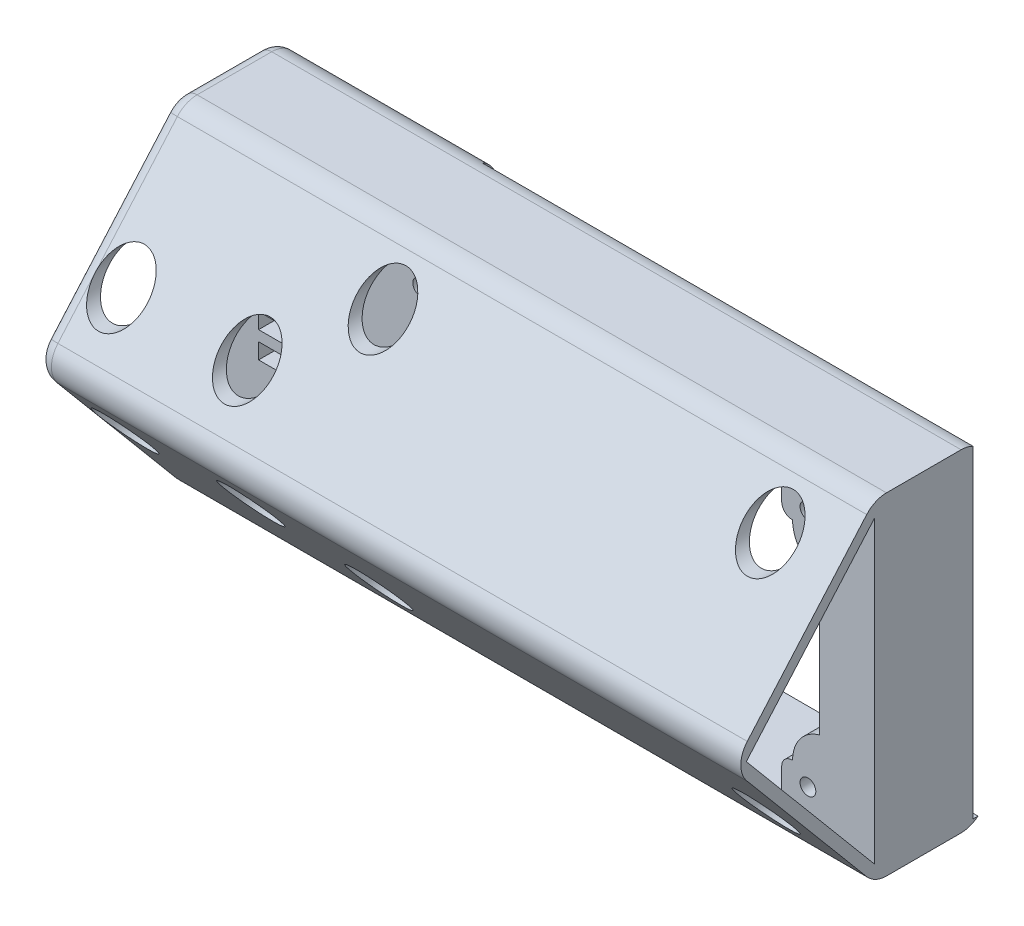
from build123d import *

# Parameters (mm, degrees)
SKETCH5_W                           = 21.5
SKETCH5_H                           = 63.28
BOSS_EXTRUDE1_DEPTH                 = 133.94
F_3_0MM_DOWEL_HOLE4_D               = 3
F_3_0MM_DOWEL_HOLE4_CSINK_D         = 3.05
F_3_0MM_DOWEL_HOLE4_CSINK_ANGLE     = 90
SKETCH8_W                           = 67.97603897
SKETCH8_H                           = 39.69603897
CUT_EXTRUDE1_DEPTH                  = 150.688115761
SKETCH9_W                           = 84.64
SKETCH9_H                           = 56.36
CUT_EXTRUDE2_DEPTH                  = 6.5
SKETCH10_W                          = 93.64
SKETCH10_H                          = 62.2
CUT_EXTRUDE3_DEPTH                  = 2.75
CUT_EXTRUDE4_DEPTH                  = 15.5
SKETCH38_R                          = 4
CUT_EXTRUDE13_DEPTH                 = 4
CUT_EXTRUDE5_START                  = -21.5
SKETCH23_W                          = 78.2
SKETCH23_H                          = 26.2
CUT_EXTRUDE5_DEPTH                  = 172.188115761
SKETCH39_W                          = 63.84
SKETCH39_H                          = 39.69603897
CUT_EXTRUDE15_DEPTH                 = 149.893525716
SKETCH30_W                          = 6
SKETCH30_H                          = 3
CUT_EXTRUDE7_DEPTH                  = 150.688115761
BOSS_EXTRUDE4_START                 = -15.5
SKETCH30_3_W                        = 6
SKETCH30_3_H                        = 2
BOSS_EXTRUDE4_DEPTH                 = 3.5
BOSS_EXTRUDE3_DEPTH                 = 133.94
SKETCH32_R                          = 1.8
CUT_EXTRUDE8_DEPTH                  = 6
FILLET1_R                           = 5
FILLET5_R                           = 2.5
FILLET8_R                           = 2.5
FILLET15_R                          = 7
FILLET16_R                          = 0.5
FILLET17_R                          = 2
FILLET18_R                          = 2
SKETCH41_W                          = 5
SKETCH41_H                          = 25.503899949
F_10_0_10_DIAMETER_HOLE1_AT_2_COUNT = 2
F_10_0_10_DIAMETER_HOLE1_AT_2_PITCH = 73.84
F_10_0_10_DIAMETER_HOLE1_AT_3_COUNT = 2
F_10_0_10_DIAMETER_HOLE1_AT_3_PITCH = 86.764389008
F_10_0_10_DIAMETER_HOLE1_AT_4_COUNT = 2
F_10_0_10_DIAMETER_HOLE1_AT_4_PITCH = 45.56
F_10_0_10_DIAMETER_HOLE1_AT_5_COUNT = 2
F_10_0_10_DIAMETER_HOLE1_AT_5_PITCH = 19.576169186
F_10_0_10_DIAMETER_HOLE1_AT_6_COUNT = 2
F_10_0_10_DIAMETER_HOLE1_AT_6_PITCH = 41.502125247
F_10_0_10_DIAMETER_HOLE1_AT_7_COUNT = 2
F_10_0_10_DIAMETER_HOLE1_AT_7_PITCH = 53.353410388
F_10_0_10_DIAMETER_HOLE1_AT_8_COUNT = 2
F_10_0_10_DIAMETER_HOLE1_AT_8_PITCH = 38.825074372


with BuildPart() as part:
    # Sketch5 → Boss-Extrude1 (new body)
    with BuildSketch(Plane(origin=(0, 0, 0), x_dir=(0, 0, -1), z_dir=(1, 0, 0))):
        with Locations((10.75, 31.64)):
            Rectangle(SKETCH5_W, SKETCH5_H)
    extrude(amount=-BOSS_EXTRUDE1_DEPTH)

    # Ø3.0mm Dowel Hole4 (through all)
    with Locations(Plane(origin=(0, 0, -21.5), x_dir=(-1, 0, 0), z_dir=(0, 0, -1))):
        with Locations((12.7, 55.06), (86.54, 55.06), (86.54, 9.5), (12.7, 9.5)):
            CounterSinkHole(F_3_0MM_DOWEL_HOLE4_D / 2, F_3_0MM_DOWEL_HOLE4_CSINK_D / 2, counter_sink_angle=F_3_0MM_DOWEL_HOLE4_CSINK_ANGLE)

    # Sketch8 → Cut-Extrude1 (cut, through all)
    with BuildSketch(Plane.XY.offset(-21.5)):
        with Locations((-49.62, 32.28)):
            Rectangle(SKETCH8_W, SKETCH8_H)
    extrude(amount=CUT_EXTRUDE1_DEPTH, mode=Mode.SUBTRACT)

    # Sketch9 → Cut-Extrude2 (cut)
    with BuildSketch(Plane.XY.offset(-21.5)):
        with Locations((-49.62, 32.28)):
            Rectangle(SKETCH9_W, SKETCH9_H)
    extrude(amount=CUT_EXTRUDE2_DEPTH, mode=Mode.SUBTRACT)

    # Sketch10 → Cut-Extrude3 (cut)
    with BuildSketch(Plane.XY.offset(-21.5)):
        with Locations((-46.72, 32.28)):
            Rectangle(SKETCH10_W, SKETCH10_H)
    extrude(amount=CUT_EXTRUDE3_DEPTH, mode=Mode.SUBTRACT)

    # Sketch13 → Cut-Extrude4 (cut)
    with BuildSketch(Plane(origin=(0, 0, -21.5), x_dir=(-1, 0, 0), z_dir=(0, 0, -1))):
        Polygon((97.34, 41.89), (83.608019485, 41.89), (83.608019485, 14.54), (131.54, 14.54), (131.54, 48.74), (97.34, 48.74), (97.34, 42.24), align=None)
    extrude(amount=-CUT_EXTRUDE4_DEPTH, mode=Mode.SUBTRACT)

    # Sketch38 → Cut-Extrude13 (cut)
    with BuildSketch(Plane(origin=(0, 0, -15), x_dir=(-1, 0, 0), z_dir=(0, 0, -1))):
        with Locations((12.7, 55.06)):
            Circle(SKETCH38_R)
        with Locations((86.54, 55.06)):
            Circle(SKETCH38_R)
        with Locations((86.54, 9.5)):
            Circle(SKETCH38_R)
        with Locations((12.7, 9.5)):
            Circle(SKETCH38_R)
    extrude(amount=-CUT_EXTRUDE13_DEPTH, mode=Mode.SUBTRACT)

    # Sketch23 → Cut-Extrude5 (cut, through all)
    with BuildSketch(Plane(origin=(0, 0, -21.5), x_dir=(1, 0, 0), z_dir=(0, 0, -1)).offset(CUT_EXTRUDE5_START)):
        with Locations((-49.62, -32.28)):
            Rectangle(SKETCH23_W, SKETCH23_H)
    extrude(amount=CUT_EXTRUDE5_DEPTH, mode=Mode.SUBTRACT)

    # Sketch39 → Cut-Extrude15 (cut, through all)
    with BuildSketch(Plane(origin=(0, 0, -15), x_dir=(-1, 0, 0), z_dir=(0, 0, -1))):
        Polygon((81.54, 60.46), (17.7, 60.46), (17.7, 55.06), (17.7, 52.128019485), (81.54, 52.128019485), (81.54, 55.06), align=None)
        Polygon((81.54, 12.431980515), (17.7, 12.431980515), (17.7, 9.5), (17.7, 4.1), (81.54, 4.1), (81.54, 9.500000148), align=None)
        with Locations((49.62, 32.28)):
            Rectangle(SKETCH39_W, SKETCH39_H)
    extrude(amount=-CUT_EXTRUDE15_DEPTH, mode=Mode.SUBTRACT)

    # Sketch30 → Cut-Extrude7 (cut, through all)
    with BuildSketch(Plane(origin=(0, 0, -21.5), x_dir=(1, 0, 0), z_dir=(0, 0, -1))):
        with Locations((-114.44, -34.14)):
            Rectangle(SKETCH30_W, SKETCH30_H)
        with Locations((-114.44, -29.14)):
            Rectangle(SKETCH30_W, SKETCH30_H)
    extrude(amount=-CUT_EXTRUDE7_DEPTH, mode=Mode.SUBTRACT)

    # Sketch31 → Boss-Extrude3 (add)
    with BuildSketch(Plane(origin=(0, 0, 0), x_dir=(0, 0, -1), z_dir=(1, 0, 0))):
        Polygon((0, 60.240346562), (0, 63.28), (-27.086136094, 32.28), (0, 0), (0, 3.111447654), (-24.453241636, 32.253686224), align=None)
    extrude(amount=-BOSS_EXTRUDE3_DEPTH)

    # Sketch32 → Cut-Extrude8 (cut)
    with BuildSketch(Plane(origin=(0, 0, -6), x_dir=(-1, 0, 0), z_dir=(0, 0, -1))):
        with Locations(Location((102.44, 43.64, 0), (0, 0, 90))):
            Circle(SKETCH32_R)
        with Locations(Location((126.44, 43.64, 0), (0, 0, 90))):
            Circle(SKETCH32_R)
        with Locations(Location((102.44, 19.64, 0), (0, 0, 90))):
            Circle(SKETCH32_R)
        with Locations(Location((126.44, 19.64, 0), (0, 0, 90))):
            Circle(SKETCH32_R)
    extrude(amount=-CUT_EXTRUDE8_DEPTH, mode=Mode.SUBTRACT)

    # Fillet1
    fillet1_edges = [part.edges().sort_by_distance(p)[0] for p in [
        (-66.97, 32.28, 27.086136094),
        (-66.97, 0, 0),
        (-66.97, 0, -21.5),
        (-66.97, 63.28, 0),
        (-113.74, 63.28, -21.5),
    ]]
    fillet(fillet1_edges, radius=FILLET1_R)

    # Fillet5
    fillet5_edges = [part.edges().sort_by_distance(p)[0] for p in [
        (-133.94, 31.675897108, 0),
    ]]
    fillet(fillet5_edges, radius=FILLET5_R)

    # Fillet8
    # the kernel refuses this fillet: 2.5 mm, written as the material it takes off along each edge
    with BuildSketch(Plane(origin=(-133.94, 58.28, -2.270983429), x_dir=(0, 1, 0), z_dir=(0, 0, -1))) as fillet8_piece_1:
        with BuildLine():
            CenterArc((5 - FILLET8_R, FILLET8_R), FILLET8_R, 270, 90)
            Line((5, FILLET8_R), (5, 0))
            Line((5, 0), (5 - FILLET8_R, 0))
        make_face()
    revolve(axis=Axis((-133.94, 58.28, -2.270983429), (1, 0, 0)), revolution_arc=48.854782739, mode=Mode.SUBTRACT)
    with BuildSketch(Plane(origin=(-133.94, 58.28, -16.5), x_dir=(0, 0, -1), z_dir=(0, -1, 0))) as fillet8_piece_2:
        with BuildLine():
            CenterArc((5 - FILLET8_R, FILLET8_R), FILLET8_R, 270, 90)
            Line((5, FILLET8_R), (5, 0))
            Line((5, 0), (5 - FILLET8_R, 0))
        make_face()
    revolve(axis=Axis((-133.94, 58.28, -16.5), (1, 0, 0)), revolution_arc=90, mode=Mode.SUBTRACT)
    with BuildSketch(Plane(origin=(-133.94, 5, -16.5), x_dir=(0, 0, -1), z_dir=(0, 1, 0))) as fillet8_piece_3:
        with BuildLine():
            CenterArc((5 - FILLET8_R, -FILLET8_R), FILLET8_R, 0, 90)
            Line((5, -FILLET8_R), (5, 0))
            Line((5, 0), (5 - FILLET8_R, 0))
        make_face()
    revolve(axis=Axis((-133.94, 5, -16.5), (-1, 0, 0)), revolution_arc=90, mode=Mode.SUBTRACT)
    with BuildSketch(Plane(origin=(-133.94, 5, -2.331538291), x_dir=(0, -1, 0), z_dir=(0, 0, -1))) as fillet8_piece_4:
        with BuildLine():
            CenterArc((5 - FILLET8_R, -FILLET8_R), FILLET8_R, 0, 90)
            Line((5, -FILLET8_R), (5, 0))
            Line((5, 0), (5 - FILLET8_R, 0))
        make_face()
    revolve(axis=Axis((-133.94, 5, -2.331538291), (-1, 0, 0)), revolution_arc=50, mode=Mode.SUBTRACT)
    with BuildSketch(Plane(origin=(-133.94, 63.28, -2.270983429), x_dir=(0, -1, 0), z_dir=(0, 0, -1))) as fillet8_piece_5:
        with BuildLine():
            CenterArc((FILLET8_R, -FILLET8_R), FILLET8_R, 90, 90)
            Line((0, -FILLET8_R), (0, 0))
            Line((0, 0), (FILLET8_R, 0))
        make_face()
    extrude(amount=14.229016571, mode=Mode.SUBTRACT)
    with BuildSketch(Plane(origin=(-133.94, 58.28, -21.5), x_dir=(0, 0, 1), z_dir=(0, -1, 0))) as fillet8_piece_6:
        with BuildLine():
            CenterArc((FILLET8_R, -FILLET8_R), FILLET8_R, 90, 90)
            Line((0, -FILLET8_R), (0, 0))
            Line((0, 0), (FILLET8_R, 0))
        make_face()
    extrude(amount=53.28, mode=Mode.SUBTRACT)
    with BuildSketch(Plane(origin=(-133.94, 0, -16.5), x_dir=(0, 1, 0), z_dir=(0, 0, 1))) as fillet8_piece_7:
        with BuildLine():
            CenterArc((FILLET8_R, -FILLET8_R), FILLET8_R, 90, 90)
            Line((0, -FILLET8_R), (0, 0))
            Line((0, 0), (FILLET8_R, 0))
        make_face()
    extrude(amount=14.168461709, mode=Mode.SUBTRACT)
    with BuildSketch(Plane(origin=(-133.94, 29.000277513, 24.334122165), x_dir=(0, 0.642787609686535, -0.7660444431189816), z_dir=(0, -0.7660444431189817, -0.642787609686535))) as fillet8_piece_8:
        with BuildLine():
            CenterArc((FILLET8_R, FILLET8_R), FILLET8_R, 180, 90)
            Line((0, FILLET8_R), (0, 0))
            Line((0, 0), (FILLET8_R, 0))
        make_face()
    extrude(amount=35.525635367, mode=Mode.SUBTRACT)
    with BuildSketch(Plane(origin=(-133.94, 61.569848729, 1.494238389), x_dir=(0, -0.6579697457800605, -0.7530443636586908), z_dir=(0, -0.7530443636586909, 0.6579697457800606))) as fillet8_piece_9:
        with BuildLine():
            CenterArc((FILLET8_R, FILLET8_R), FILLET8_R, 180, 90)
            Line((0, FILLET8_R), (0, 0))
            Line((0, 0), (FILLET8_R, 0))
        make_face()
    extrude(amount=34.613876283, mode=Mode.SUBTRACT)
    with BuildSketch(Plane(origin=(-133.94, 32.214215561, 20.503899949), x_dir=(0, -0.6427876096865348, 0.7660444431189818), z_dir=(0, -0.7660444431189818, -0.6427876096865348))) as fillet8_piece_10:
        with BuildLine():
            CenterArc((5 - FILLET8_R, -FILLET8_R), FILLET8_R, 0, 90)
            Line((5, -FILLET8_R), (5, 0))
            Line((5, 0), (5 - FILLET8_R, 0))
        make_face()
    revolve(axis=Axis((-133.94, 32.214215561, 20.503899949), (-1, 0, 0)), revolution_arc=81.145217261, mode=Mode.SUBTRACT)

    # Fillet15
    # the kernel refuses this fillet: 7 mm, written as the material it takes off along each edge
    with BuildSketch(Plane(origin=(-83.608019485, 45.38, 0), x_dir=(0, 1, 0), z_dir=(0, 0, -1)), Plane(origin=(-15.631980515, 45.38, -31.851443266), x_dir=(0, 1, 0), z_dir=(0, 0, 1))) as fillet15_piece_1:
        with BuildLine():
            CenterArc((6.740577307, -7), FILLET15_R, 90, 74.352568478)
            Line((0, -5.111980515), (0, 0))
            Line((0, 0), (6.740577307, 0))
        make_face()
    extrude(amount=31.851443266, mode=Mode.SUBTRACT)
    with BuildSketch(Plane(origin=(-15.631980515, 19.18, 0), x_dir=(1, 0, 0), z_dir=(0, 0, -1))) as fillet15_piece_2:
        with BuildLine():
            CenterArc((7, 6.740577307), FILLET15_R, 180, 74.352568478)
            Line((0, 6.740577307), (0, 0))
            Line((0, 0), (5.111980515, 0))
        make_face()
    extrude(amount=31.851443266, mode=Mode.SUBTRACT)
    with BuildSketch(Plane(origin=(-83.608019485, 19.18, -22.851443266), x_dir=(-1, 0, 0), z_dir=(0, 0, 1))) as fillet15_piece_3:
        with BuildLine():
            CenterArc((7, 6.740577307), FILLET15_R, 180, 74.352568478)
            Line((0, 6.740577307), (0, 0))
            Line((0, 0), (5.111980515, 0))
        make_face()
    extrude(amount=22.851443266, mode=Mode.SUBTRACT)

    # Fillet17
    fillet17_edges = [part.edges().sort_by_distance(p)[0] for p in [
        (-97.34, 48.74, -13.75),
        (-97.34, 41.89, -13.75),
    ]]
    fillet(fillet17_edges, radius=FILLET17_R)

    # Fillet18
    fillet18_edges = [part.edges().sort_by_distance(p)[0] for p in [
        (-17.7, 12.431980515, -7.5),
        (-81.54, 12.431980515, -7.5),
        (-81.54, 52.128019485, -7.5),
        (-17.7, 52.128019485, -7.5),
    ]]
    fillet(fillet18_edges, radius=FILLET18_R)

    # Sketch41 → Ø10.0 (10) Diameter Hole1 (revolve, cut)
    with BuildSketch(Plane(origin=(-86.54, 55.06, 0), x_dir=(0, 1, 0), z_dir=(1, 0, 0))):
        with Locations((2.5, 12.751949975)):
            Rectangle(SKETCH41_W, SKETCH41_H)
    f_10_0_10_diameter_hole1 = revolve(axis=Axis((-86.54, 55.06, -6.35), (0, 0, 1)), mode=Mode.SUBTRACT)

    # Ø10.0 (10) Diameter Hole1 at 2: Ø10.0 (10) Diameter Hole1 ×2
    with Locations(*[(i * F_10_0_10_DIAMETER_HOLE1_AT_2_PITCH, 0, 0) for i in range(1, F_10_0_10_DIAMETER_HOLE1_AT_2_COUNT)]):
        add(f_10_0_10_diameter_hole1, mode=Mode.SUBTRACT)

    # Ø10.0 (10) Diameter Hole1 at 3: Ø10.0 (10) Diameter Hole1 ×2
    with Locations(*[Vector(0.8510403962258758, -0.5251002228067556, 0) * (i * F_10_0_10_DIAMETER_HOLE1_AT_3_PITCH) for i in range(1, F_10_0_10_DIAMETER_HOLE1_AT_3_COUNT)]):
        add(f_10_0_10_diameter_hole1, mode=Mode.SUBTRACT)

    # Ø10.0 (10) Diameter Hole1 at 4: Ø10.0 (10) Diameter Hole1 ×2
    with Locations(*[(0, -i * F_10_0_10_DIAMETER_HOLE1_AT_4_PITCH, 0) for i in range(1, F_10_0_10_DIAMETER_HOLE1_AT_4_COUNT)]):
        add(f_10_0_10_diameter_hole1, mode=Mode.SUBTRACT)

    # Ø10.0 (10) Diameter Hole1 at 5: Ø10.0 (10) Diameter Hole1 ×2
    with Locations(*[Vector(-0.8122120241660007, -0.5833623469167066, 0) * (i * F_10_0_10_DIAMETER_HOLE1_AT_5_PITCH) for i in range(1, F_10_0_10_DIAMETER_HOLE1_AT_5_COUNT)]):
        add(f_10_0_10_diameter_hole1, mode=Mode.SUBTRACT)

    # Ø10.0 (10) Diameter Hole1 at 6: Ø10.0 (10) Diameter Hole1 ×2
    with Locations(*[Vector(-0.9613965492788573, -0.2751666313976055, 0) * (i * F_10_0_10_DIAMETER_HOLE1_AT_6_PITCH) for i in range(1, F_10_0_10_DIAMETER_HOLE1_AT_6_COUNT)]):
        add(f_10_0_10_diameter_hole1, mode=Mode.SUBTRACT)

    # Ø10.0 (10) Diameter Hole1 at 7: Ø10.0 (10) Diameter Hole1 ×2
    with Locations(*[Vector(-0.7478434782340897, -0.6638750876955234, 0) * (i * F_10_0_10_DIAMETER_HOLE1_AT_7_PITCH) for i in range(1, F_10_0_10_DIAMETER_HOLE1_AT_7_COUNT)]):
        add(f_10_0_10_diameter_hole1, mode=Mode.SUBTRACT)

    # Ø10.0 (10) Diameter Hole1 at 8: Ø10.0 (10) Diameter Hole1 ×2
    with Locations(*[Vector(-0.4095291575647607, -0.9122970289901736, 0) * (i * F_10_0_10_DIAMETER_HOLE1_AT_8_PITCH) for i in range(1, F_10_0_10_DIAMETER_HOLE1_AT_8_COUNT)]):
        add(f_10_0_10_diameter_hole1, mode=Mode.SUBTRACT)


with BuildPart() as body_2:
    # Sketch30<3> → Boss-Extrude4 (new body)
    with BuildSketch(Plane(origin=(0, 0, -21.5), x_dir=(1, 0, 0), z_dir=(0, 0, -1)).offset(BOSS_EXTRUDE4_START)):
        with Locations((-114.44, -31.64)):
            Rectangle(SKETCH30_3_W, SKETCH30_3_H)
    extrude(amount=BOSS_EXTRUDE4_DEPTH)

    # Fillet16
    fillet16_edges = [body_2.edges().sort_by_distance(p)[0] for p in [
        (-111.44, 31.64, -9.5),
        (-114.44, 30.64, -9.5),
        (-117.44, 31.64, -9.5),
        (-114.44, 32.64, -9.5),
    ]]
    fillet(fillet16_edges, radius=FILLET16_R)


solid = Compound([part.part, body_2.part])
